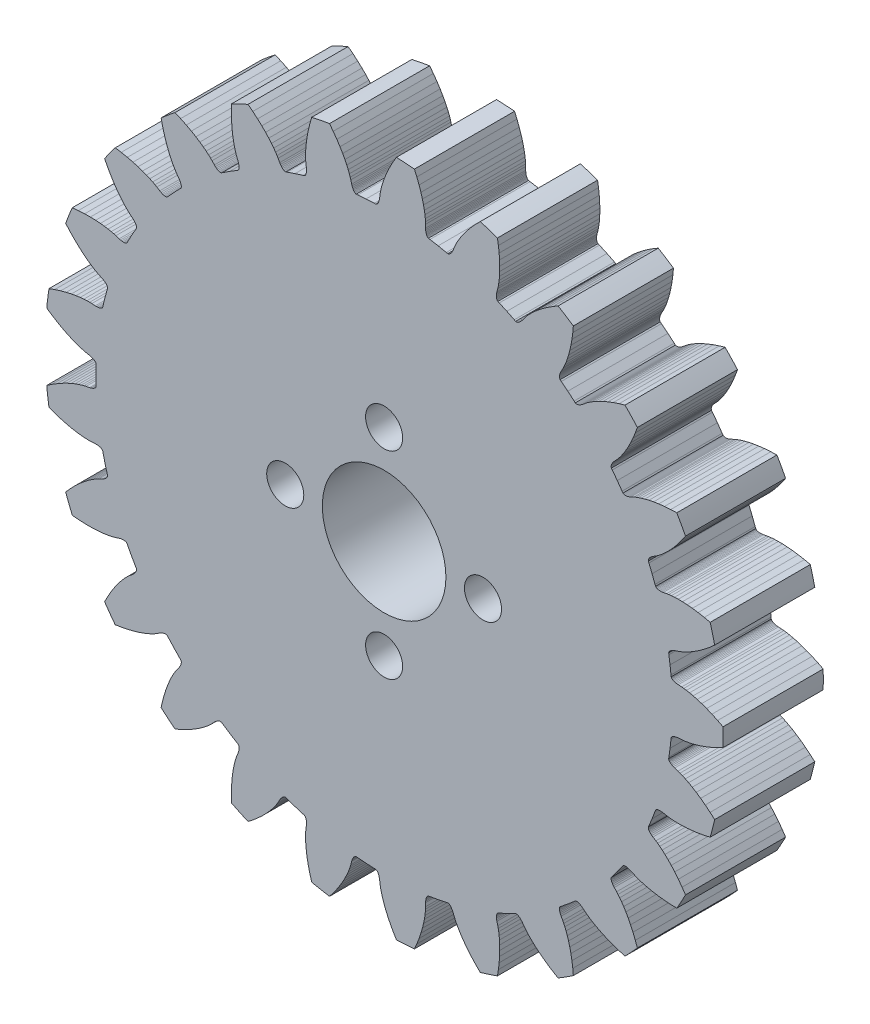
from build123d import *
from build123d.topology import SkipClean

# Parameters (mm, degrees)
BOSS_EXTRUDE1_DEPTH      = 8
BOSS_EXTRUDE1_DEPTH_BACK = 0.1
SKETCH1_R                = 2.032
SKETCH2_R                = 5
CUT_EXTRUDE1_DEPTH       = 10
SKETCH3_R                = 1.5
CUT_EXTRUDE2_DEPTH       = 61.018493099
SKETCH4_R                = 11
SKETCH4_R_2              = 1.5
SKETCH4_R_3              = 5
BOSS_EXTRUDE2_DEPTH      = 3


with BuildPart() as part:
    # Sketch1 → Boss-Extrude1 (new, two sides: drawn at the far end of the back side and taken through both)
    with BuildSketch(Plane.XY.offset(-BOSS_EXTRUDE1_DEPTH_BACK)):
        with BuildLine():
            Line((51.445940215, 5.273928948), (51.051911742, 4.954092656))
            Line((51.051911742, 4.954092656), (50.678490696, 4.676061411))
            Line((50.678490696, 4.676061411), (50.326925333, 4.436521021))
            Line((50.326925333, 4.436521021), (50.003011528, 4.23514911))
            Line((50.003011528, 4.23514911), (49.707087304, 4.06789204))
            Line((49.707087304, 4.06789204), (49.441380546, 3.93203059))
            Line((49.441380546, 3.93203059), (49.20848185, 3.824973451))
            Line((49.20848185, 3.824973451), (49.009888597, 3.743540746))
            Line((49.009888597, 3.743540746), (48.84710335, 3.684593848))
            Line((48.84710335, 3.684593848), (48.582403143, 3.600022313))
            Line((48.582403143, 3.600022313), (48.479969413, 3.559616298))
            Line((48.479969413, 3.559616298), (48.38955598, 3.516960046))
            Line((48.38955598, 3.516960046), (48.311184686, 3.472527724))
            Line((48.311184686, 3.472527724), (48.244904097, 3.426826927))
            Line((48.244904097, 3.426826927), (48.190727421, 3.380320441))
            Line((48.190727421, 3.380320441), (48.148631493, 3.333517182))
            Line((48.148631493, 3.333517182), (48.118629318, 3.286879734))
            Line((48.118629318, 3.286879734), (48.100677512, 3.240914573))
            Line((48.100677512, 3.240914573), (48.094727613, 3.196086723))
            Line((48.094727613, 3.196086723), (48.112060776, 3.074363319))
            Line((48.112060776, 3.074363319), (48.205688529, 2.409666756))
            Line((48.205688529, 2.409666756), (48.280305601, 1.742568573))
            Line((48.280305601, 1.742568573), (48.293788328, 1.620358708))
            Line((48.293788328, 1.620358708), (48.310699546, 1.57841894))
            Line((48.310699546, 1.57841894), (48.339518386, 1.538362327))
            Line((48.339518386, 1.538362327), (48.380176268, 1.500651252))
            Line((48.380176268, 1.500651252), (48.432589269, 1.465787313))
            Line((48.432589269, 1.465787313), (48.496629476, 1.434215012))
            Line((48.496629476, 1.434215012), (48.572193054, 1.406433406))
            Line((48.572193054, 1.406433406), (48.659152088, 1.382887098))
            Line((48.659152088, 1.382887098), (48.757333248, 1.364055944))
            Line((48.757333248, 1.364055944), (48.866597342, 1.350393488))
            Line((48.866597342, 1.350393488), (49.1440135, 1.334307261))
            Line((49.1440135, 1.334307261), (49.316344169, 1.317695356))
            Line((49.316344169, 1.317695356), (49.528949688, 1.288209106))
            Line((49.528949688, 1.288209106), (49.781155533, 1.242434953))
            Line((49.781155533, 1.242434953), (50.072302017, 1.176920428))
            Line((50.072302017, 1.176920428), (50.400524272, 1.08851136))
            Line((50.400524272, 1.08851136), (50.764340968, 0.974019945))
            Line((50.764340968, 0.974019945), (51.164432523, 0.829436033))
            Line((51.164432523, 0.829436033), (51.595265392, 0.653005601))
            Line((51.595265392, 0.653005601), (52.056454716, 0.441208514))
            Line((52.056454716, 0.441208514), (52.494586632, 0.218276168))
            ThreePointArc((52.494586632, 0.218276168), (52.504328888, -0.512753358), (52.494586634, -1.243782885))
            Line((52.494586634, -1.243782885), (52.056454752, -1.466715128))
            Line((52.056454752, -1.466715128), (51.595265428, -1.678512215))
            Line((51.595265428, -1.678512215), (51.164432558, -1.854942647))
            Line((51.164432558, -1.854942647), (50.764341004, -1.999526559))
            Line((50.764341004, -1.999526559), (50.400524307, -2.114017973))
            Line((50.400524307, -2.114017973), (50.072302053, -2.202427042))
            Line((50.072302053, -2.202427042), (49.781155569, -2.267941567))
            Line((49.781155569, -2.267941567), (49.528949723, -2.31371572))
            Line((49.528949723, -2.31371572), (49.316344205, -2.34320197))
            Line((49.316344205, -2.34320197), (49.144013536, -2.359813875))
            Line((49.144013536, -2.359813875), (48.866597377, -2.375900101))
            Line((48.866597377, -2.375900101), (48.757333283, -2.389562558))
            Line((48.757333283, -2.389562558), (48.659152123, -2.408393712))
            Line((48.659152123, -2.408393712), (48.572193089, -2.43194002))
            Line((48.572193089, -2.43194002), (48.496629512, -2.459721625))
            Line((48.496629512, -2.459721625), (48.432589305, -2.491293927))
            Line((48.432589305, -2.491293927), (48.380176303, -2.526157865))
            Line((48.380176303, -2.526157865), (48.339518421, -2.56386894))
            Line((48.339518421, -2.56386894), (48.310699581, -2.603925553))
            Line((48.310699581, -2.603925553), (48.293788363, -2.645865322))
            Line((48.293788363, -2.645865322), (48.280305637, -2.768075187))
            Line((48.280305637, -2.768075187), (48.205688565, -3.43517337))
            Line((48.205688565, -3.43517337), (48.112060812, -4.099869932))
            Line((48.112060812, -4.099869932), (48.094727649, -4.221593336))
            Line((48.094727649, -4.221593336), (48.100677548, -4.266421187))
            Line((48.100677548, -4.266421187), (48.118629353, -4.312386348))
            Line((48.118629353, -4.312386348), (48.148631529, -4.359023796))
            Line((48.148631529, -4.359023796), (48.190727457, -4.405827055))
            Line((48.190727457, -4.405827055), (48.244904133, -4.45233354))
            Line((48.244904133, -4.45233354), (48.311184721, -4.498034338))
            Line((48.311184721, -4.498034338), (48.389556015, -4.54246666))
            Line((48.389556015, -4.54246666), (48.479969449, -4.585122912))
            Line((48.479969449, -4.585122912), (48.582403178, -4.625528927))
            Line((48.582403178, -4.625528927), (48.847103385, -4.710100462))
            Line((48.847103385, -4.710100462), (49.009888633, -4.76904736))
            Line((49.009888633, -4.76904736), (49.208481885, -4.850480064))
            Line((49.208481885, -4.850480064), (49.441380581, -4.957537204))
            Line((49.441380581, -4.957537204), (49.70708734, -5.093398654))
            Line((49.70708734, -5.093398654), (50.003011564, -5.260655724))
            Line((50.003011564, -5.260655724), (50.326925369, -5.462027635))
            Line((50.326925369, -5.462027635), (50.678490731, -5.701568024))
            Line((50.678490731, -5.701568024), (51.051911777, -5.979599269))
            Line((51.051911777, -5.979599269), (51.44594025, -6.299435561))
            Line((51.44594025, -6.299435561), (51.814866411, -6.624322999))
            ThreePointArc((51.814866411, -6.624322999), (51.642502956, -7.334808644), (51.451267136, -8.04044869))
            Line((51.451267136, -8.04044869), (50.97145887, -8.147418242))
            Line((50.97145887, -8.147418242), (50.472086843, -8.23786815))
            Line((50.472086843, -8.23786815), (50.010912963, -8.301611889))
            Line((50.010912963, -8.301611889), (49.587434307, -8.342154759))
            Line((49.587434307, -8.342154759), (49.20657482, -8.362571685))
            Line((49.20657482, -8.362571685), (48.866677811, -8.366577672))
            Line((48.866677811, -8.366577672), (48.568385495, -8.357628744))
            Line((48.568385495, -8.357628744), (48.312719559, -8.339243716))
            Line((48.312719559, -8.339243716), (48.099460448, -8.314930836))
            Line((48.099460448, -8.314930836), (47.928412784, -8.288163909))
            Line((47.928412784, -8.288163909), (47.655711577, -8.234754212))
            Line((47.655711577, -8.234754212), (47.546482535, -8.22081459))
            Line((47.546482535, -8.22081459), (47.4467028, -8.214637412))
            Line((47.4467028, -8.214637412), (47.356619973, -8.215818207))
            Line((47.356619973, -8.215818207), (47.276521378, -8.223935133))
            Line((47.276521378, -8.223935133), (47.206641406, -8.238589307))
            Line((47.206641406, -8.238589307), (47.147204695, -8.259323429))
            Line((47.147204695, -8.259323429), (47.098445839, -8.285738413))
            Line((47.098445839, -8.285738413), (47.060570679, -8.317369642))
            Line((47.060570679, -8.317369642), (47.033760776, -8.353786232))
            Line((47.033760776, -8.353786232), (46.990309301, -8.468803528))
            Line((46.990309301, -8.468803528), (46.752135939, -9.096387134))
            Line((46.752135939, -9.096387134), (46.496146307, -9.716916754))
            Line((46.496146307, -9.716916754), (46.449086304, -9.830505351))
            Line((46.449086304, -9.830505351), (46.443701098, -9.875404626))
            Line((46.443701098, -9.875404626), (46.449657804, -9.92439005))
            Line((46.449657804, -9.92439005), (46.467119085, -9.977023524))
            Line((46.467119085, -9.977023524), (46.496253088, -10.032825292))
            Line((46.496253088, -10.032825292), (46.537162023, -10.091343844))
            Line((46.537162023, -10.091343844), (46.589994938, -10.152092109))
            Line((46.589994938, -10.152092109), (46.654854143, -10.214618781))
            Line((46.654854143, -10.214618781), (46.731818987, -10.278419721))
            Line((46.731818987, -10.278419721), (46.820985891, -10.343030615))
            Line((46.820985891, -10.343030615), (47.056338023, -10.490773373))
            Line((47.056338023, -10.490773373), (47.199349574, -10.588351435))
            Line((47.199349574, -10.588351435), (47.371452151, -10.716613917))
            Line((47.371452151, -10.716613917), (47.570409944, -10.878227208))
            Line((47.570409944, -10.878227208), (47.793981659, -11.075898847))
            Line((47.793981659, -11.075898847), (48.03901363, -11.311494617))
            Line((48.03901363, -11.311494617), (48.302671929, -11.587094167))
            Line((48.302671929, -11.587094167), (48.583621024, -11.906539705))
            Line((48.583621024, -11.906539705), (48.876166743, -12.268702151))
            Line((48.876166743, -12.268702151), (49.178276071, -12.676481066))
            Line((49.178276071, -12.676481066), (49.454815523, -13.082909717))
            ThreePointArc((49.454815523, -13.082909717), (49.11117659, -13.728209127), (48.750463251, -14.364121803))
            Line((48.750463251, -14.364121803), (48.259126861, -14.348407201))
            Line((48.259126861, -14.348407201), (47.752949463, -14.311826731))
            Line((47.752949463, -14.311826731), (47.290411806, -14.258878602))
            Line((47.290411806, -14.258878602), (46.870154988, -14.192832912))
            Line((46.870154988, -14.192832912), (46.496183371, -14.117892448))
            Line((46.496183371, -14.117892448), (46.165968538, -14.037243587))
            Line((46.165968538, -14.037243587), (45.87927315, -13.954393562))
            Line((45.87927315, -13.954393562), (45.636211609, -13.873004647))
            Line((45.636211609, -13.873004647), (45.435698827, -13.796420091))
            Line((45.435698827, -13.796420091), (45.276681518, -13.727956423))
            Line((45.276681518, -13.727956423), (45.025830203, -13.608406548))
            Line((45.025830203, -13.608406548), (44.923499496, -13.567740741))
            Line((44.923499496, -13.567740741), (44.82839072, -13.536943444))
            Line((44.82839072, -13.536943444), (44.740844438, -13.515684356))
            Line((44.740844438, -13.515684356), (44.661243683, -13.503626569))
            Line((44.661243683, -13.503626569), (44.589914692, -13.500441917))
            Line((44.589914692, -13.500441917), (44.527188986, -13.505743405))
            Line((44.527188986, -13.505743405), (44.473392802, -13.519202662))
            Line((44.473392802, -13.519202662), (44.428841202, -13.540421009))
            Line((44.428841202, -13.540421009), (44.393817142, -13.569026083))
            Line((44.393817142, -13.569026083), (44.323127113, -13.669624002))
            Line((44.323127113, -13.669624002), (43.936362634, -14.218259532))
            Line((43.936362634, -14.218259532), (43.534096026, -14.755632092))
            Line((43.534096026, -14.755632092), (43.460266151, -14.853948786))
            Line((43.460266151, -14.853948786), (43.443884066, -14.896098156))
            Line((43.443884066, -14.896098156), (43.43747148, -14.945026074))
            Line((43.43747148, -14.945026074), (43.44129479, -15.000348392))
            Line((43.44129479, -15.000348392), (43.455636239, -15.061642351))
            Line((43.455636239, -15.061642351), (43.480706852, -15.128496065))
            Line((43.480706852, -15.128496065), (43.516772515, -15.20047489))
            Line((43.516772515, -15.20047489), (43.564044252, -15.277166939))
            Line((43.564044252, -15.277166939), (43.62272445, -15.358103836))
            Line((43.62272445, -15.358103836), (43.693021998, -15.442859775))
            Line((43.693021998, -15.442859775), (43.884237871, -15.644490563))
            Line((43.884237871, -15.644490563), (43.998489916, -15.774568535))
            Line((43.998489916, -15.774568535), (44.133287919, -15.941601678))
            Line((44.133287919, -15.941601678), (44.28580354, -16.147616303))
            Line((44.28580354, -16.147616303), (44.453192385, -16.394677836))
            Line((44.453192385, -16.394677836), (44.631935944, -16.68380888))
            Line((44.631935944, -16.68380888), (44.818772146, -17.016319163))
            Line((44.818772146, -17.016319163), (45.011451873, -17.395597856))
            Line((45.011451873, -17.395597856), (45.20474059, -17.81913554))
            Line((45.20474059, -17.81913554), (45.39594803, -18.289234778))
            Line((45.39594803, -18.289234778), (45.562724735, -18.751667381))
            ThreePointArc((45.562724735, -18.751667381), (45.069402391, -19.291233998), (44.56187645, -19.81746255))
            Line((44.56187645, -19.81746255), (44.089884406, -19.680051205))
            Line((44.089884406, -19.680051205), (43.608706806, -19.518738853))
            Line((43.608706806, -19.518738853), (43.173868255, -19.352425648))
            Line((43.173868255, -19.352425648), (42.78323942, -19.18394125))
            Line((42.78323942, -19.18394125), (42.439653823, -19.018352249))
            Line((42.439653823, -19.018352249), (42.139869815, -18.858116146))
            Line((42.139869815, -18.858116146), (41.882785442, -18.706570704))
            Line((41.882785442, -18.706570704), (41.667600808, -18.567291836))
            Line((41.667600808, -18.567291836), (41.492433264, -18.443247888))
            Line((41.492433264, -18.443247888), (41.355437957, -18.337389019))
            Line((41.355437957, -18.337389019), (41.142198455, -18.159210965))
            Line((41.142198455, -18.159210965), (41.053195839, -18.094374011))
            Line((41.053195839, -18.094374011), (40.968734032, -18.040891669))
            Line((40.968734032, -18.040891669), (40.889225021, -17.998528635))
            Line((40.889225021, -17.998528635), (40.815123772, -17.967053768))
            Line((40.815123772, -17.967053768), (40.746827744, -17.946230441))
            Line((40.746827744, -17.946230441), (40.684754208, -17.935765946))
            Line((40.684754208, -17.935765946), (40.62930103, -17.93542396))
            Line((40.62930103, -17.93542396), (40.580872272, -17.944896128))
            Line((40.580872272, -17.944896128), (40.539834712, -17.963892382))
            Line((40.539834712, -17.963892382), (40.446347878, -18.04374988))
            Line((40.446347878, -18.04374988), (39.93529429, -18.478964656))
            Line((39.93529429, -18.478964656), (39.412026452, -18.899415022))
            Line((39.412026452, -18.899415022), (39.316065658, -18.976282128))
            Line((39.316065658, -18.976282128), (39.289716206, -19.013033286))
            Line((39.289716206, -19.013033286), (39.271337274, -19.058829283))
            Line((39.271337274, -19.058829283), (39.261282328, -19.113364404))
            Line((39.261282328, -19.113364404), (39.259929931, -19.176299203))
            Line((39.259929931, -19.176299203), (39.267587116, -19.247287428))
            Line((39.267587116, -19.247287428), (39.284619239, -19.325973986))
            Line((39.284619239, -19.325973986), (39.311333435, -19.412012727))
            Line((39.311333435, -19.412012727), (39.34804182, -19.504999993))
            Line((39.34804182, -19.504999993), (39.395052952, -19.60457541))
            Line((39.395052952, -19.60457541), (39.530117859, -19.847425115))
            Line((39.530117859, -19.847425115), (39.608431342, -20.001829784))
            Line((39.608431342, -20.001829784), (39.697454989, -20.197138106))
            Line((39.697454989, -20.197138106), (39.79394522, -20.434609513))
            Line((39.79394522, -20.434609513), (39.894633564, -20.715537069))
            Line((39.894633564, -20.715537069), (39.995857644, -21.040036293))
            Line((39.995857644, -21.040036293), (40.094132072, -21.408564385))
            Line((40.094132072, -21.408564385), (40.186435571, -21.823844835))
            Line((40.186435571, -21.823844835), (40.268322326, -22.282145264))
            Line((40.268322326, -22.282145264), (40.33661368, -22.78502686))
            Line((40.33661368, -22.78502686), (40.383148512, -23.274406932))
            ThreePointArc((40.383148512, -23.274406932), (39.771140033, -23.674337779), (39.148691232, -24.05781731))
            Line((39.148691232, -24.05781731), (38.725700501, -23.807343485))
            Line((38.725700501, -23.807343485), (38.299756725, -23.531434969))
            Line((38.299756725, -23.531434969), (37.919939857, -23.262206856))
            Line((37.919939857, -23.262206856), (37.583483736, -23.001870369))
            Line((37.583483736, -23.001870369), (37.291872736, -22.756037383))
            Line((37.291872736, -22.756037383), (37.041356194, -22.526281988))
            Line((37.041356194, -22.526281988), (36.830036424, -22.315563385))
            Line((36.830036424, -22.315563385), (36.65624942, -22.127145982))
            Line((36.65624942, -22.127145982), (36.517433544, -21.963436682))
            Line((36.517433544, -21.963436682), (36.4110683, -21.826834263))
            Line((36.4110683, -21.826834263), (36.248839212, -21.601223437))
            Line((36.248839212, -21.601223437), (36.178756954, -21.516289393))
            Line((36.178756954, -21.516289393), (36.110249192, -21.443482528))
            Line((36.110249192, -21.443482528), (36.043773429, -21.382677366))
            Line((36.043773429, -21.382677366), (35.979827608, -21.333763164))
            Line((35.979827608, -21.333763164), (35.918855823, -21.296609365))
            Line((35.918855823, -21.296609365), (35.861334881, -21.271036746))
            Line((35.861334881, -21.271036746), (35.807708877, -21.256914753))
            Line((35.807708877, -21.256914753), (35.758445984, -21.254045569))
            Line((35.758445984, -21.254045569), (35.71397353, -21.262239406))
            Line((35.71397353, -21.262239406), (35.603563997, -21.316338866))
            Line((35.603563997, -21.316338866), (35.000332488, -21.61078674))
            Line((35.000332488, -21.61078674), (34.388942398, -21.887896473))
            Line((34.388942398, -21.887896473), (34.276880341, -21.938484129))
            Line((34.276880341, -21.938484129), (34.242219095, -21.96752781))
            Line((34.242219095, -21.96752781), (34.2130285, -22.00731437))
            Line((34.2130285, -22.00731437), (34.18972715, -22.05763563))
            Line((34.18972715, -22.05763563), (34.172766046, -22.118256896))
            Line((34.172766046, -22.118256896), (34.162528525, -22.188919188))
            Line((34.162528525, -22.188919188), (34.159457056, -22.269369421))
            Line((34.159457056, -22.269369421), (34.163934974, -22.359348514))
            Line((34.163934974, -22.359348514), (34.176365124, -22.458543541))
            Line((34.176365124, -22.458543541), (34.197135822, -22.566681704))
            Line((34.197135822, -22.566681704), (34.267563215, -22.835491225))
            Line((34.267563215, -22.835491225), (34.305017445, -23.004520706))
            Line((34.305017445, -23.004520706), (34.342673047, -23.215832349))
            Line((34.342673047, -23.215832349), (34.377075213, -23.469839359))
            Line((34.377075213, -23.469839359), (34.404736321, -23.766981158))
            Line((34.404736321, -23.766981158), (34.422080559, -24.106459066))
            Line((34.422080559, -24.106459066), (34.425618372, -24.487849007))
            Line((34.425618372, -24.487849007), (34.411745908, -24.91303759))
            Line((34.411745908, -24.91303759), (34.377085373, -25.377304074))
            Line((34.377085373, -25.377304074), (34.318169667, -25.881370122))
            Line((34.318169667, -25.881370122), (34.24153868, -26.366948119))
            ThreePointArc((34.24153868, -26.366948119), (33.549298816, -26.602114095), (32.851037908, -26.818749202))
            Line((32.851037908, -26.818749202), (32.503626485, -26.470950861))
            Line((32.503626485, -26.470950861), (32.159680106, -26.097782697))
            Line((32.159680106, -26.097782697), (31.858750152, -25.74255628))
            Line((31.858750152, -25.74255628), (31.59760757, -25.406725405))
            Line((31.59760757, -25.406725405), (31.376294221, -25.096094987))
            Line((31.376294221, -25.096094987), (31.19078593, -24.811256949))
            Line((31.19078593, -24.811256949), (31.038508765, -24.554605291))
            Line((31.038508765, -24.554605291), (30.917039056, -24.328888292))
            Line((30.917039056, -24.328888292), (30.823297206, -24.135800134))
            Line((30.823297206, -24.135800134), (30.754245274, -23.977037434))
            Line((30.754245274, -23.977037434), (30.653220025, -23.718169778))
            Line((30.653220025, -23.718169778), (30.606461775, -23.618475387))
            Line((30.606461775, -23.618475387), (30.558212646, -23.530918743))
            Line((30.558212646, -23.530918743), (30.508947009, -23.45549202))
            Line((30.508947009, -23.45549202), (30.459174592, -23.392211781))
            Line((30.459174592, -23.392211781), (30.40935808, -23.341062277))
            Line((30.40935808, -23.341062277), (30.360003949, -23.301988136))
            Line((30.360003949, -23.301988136), (30.311574684, -23.274973509))
            Line((30.311574684, -23.274973509), (30.264573101, -23.259943313))
            Line((30.264573101, -23.259943313), (30.21946006, -23.256819926))
            Line((30.21946006, -23.256819926), (30.099065279, -23.281762015))
            Line((30.099065279, -23.281762015), (29.441559253, -23.416941627))
            Line((29.441559253, -23.416941627), (28.780462684, -23.533298926))
            Line((28.780462684, -23.533298926), (28.659340549, -23.554428576))
            Line((28.659340549, -23.554428576), (28.618545405, -23.573939942))
            Line((28.618545405, -23.573939942), (28.580377333, -23.605217095))
            Line((28.580377333, -23.605217095), (28.545293634, -23.648162603))
            Line((28.545293634, -23.648162603), (28.513789506, -23.702661249))
            Line((28.513789506, -23.702661249), (28.486300712, -23.768557688))
            Line((28.486300712, -23.768557688), (28.463318487, -23.845716487))
            Line((28.463318487, -23.845716487), (28.445278899, -23.933982402))
            Line((28.445278899, -23.933982402), (28.432649714, -24.033152231))
            Line((28.432649714, -24.033152231), (28.425875026, -24.143058641))
            Line((28.425875026, -24.143058641), (28.427239616, -24.420937486))
            Line((28.427239616, -24.420937486), (28.421481233, -24.593971023))
            Line((28.421481233, -24.593971023), (28.405402728, -24.808008594))
            Line((28.405402728, -24.808008594), (28.375555086, -25.062590863))
            Line((28.375555086, -25.062590863), (28.328451091, -25.357276482))
            Line((28.328451091, -25.357276482), (28.260825623, -25.69040246))
            Line((28.260825623, -25.69040246), (28.169404419, -26.060690163))
            Line((28.169404419, -26.060690163), (28.050227721, -26.469070753))
            Line((28.050227721, -26.469070753), (27.901197691, -26.910131593))
            Line((27.901197691, -26.910131593), (27.718776923, -27.383709818))
            Line((27.718776923, -27.383709818), (27.523795042, -27.834975159))
            ThreePointArc((27.523795042, -27.834975159), (26.79481981, -27.890599899), (26.064621135, -27.926778581))
            Line((26.064621135, -27.926778581), (25.814618068, -27.503509296))
            Line((25.814618068, -27.503509296), (25.574280626, -27.056528833))
            Line((25.574280626, -27.056528833), (25.371146158, -26.63762421))
            Line((25.371146158, -26.63762421), (25.201725516, -26.247400657))
            Line((25.201725516, -26.247400657), (25.064615808, -25.891490879))
            Line((25.064615808, -25.891490879), (24.955771932, -25.569467444))
            Line((24.955771932, -25.569467444), (24.872105449, -25.283009292))
            Line((24.872105449, -25.283009292), (24.810585532, -25.034175245))
            Line((24.810585532, -25.034175245), (24.767807868, -24.82384069))
            Line((24.767807868, -24.82384069), (24.740407973, -24.652893204))
            Line((24.740407973, -24.652893204), (24.706934329, -24.377034472))
            Line((24.706934329, -24.377034472), (24.686438155, -24.268843883))
            Line((24.686438155, -24.268843883), (24.661479302, -24.172038895))
            Line((24.661479302, -24.172038895), (24.632519238, -24.086729947))
            Line((24.632519238, -24.086729947), (24.600047776, -24.013059889))
            Line((24.600047776, -24.013059889), (24.564516631, -23.951128491))
            Line((24.564516631, -23.951128491), (24.526430448, -23.901007992))
            Line((24.526430448, -23.901007992), (24.486240943, -23.862798264))
            Line((24.486240943, -23.862798264), (24.444453777, -23.836551428))
            Line((24.444453777, -23.836551428), (24.401534889, -23.822307006))
            Line((24.401534889, -23.822307006), (24.27871959, -23.816524544))
            Line((24.27871959, -23.816524544), (23.608252554, -23.783942135))
            Line((23.608252554, -23.783942135), (22.938988665, -23.732235863))
            Line((22.938988665, -23.732235863), (22.816417104, -23.722579901))
            Line((22.816417104, -23.722579901), (22.772051331, -23.731332842))
            Line((22.772051331, -23.731332842), (22.727304049, -23.752135341))
            Line((22.727304049, -23.752135341), (22.682642518, -23.7850067))
            Line((22.682642518, -23.7850067), (22.638574839, -23.829958502))
            Line((22.638574839, -23.829958502), (22.595561869, -23.886948381))
            Line((22.595561869, -23.886948381), (22.554113133, -23.955967699))
            Line((22.554113133, -23.955967699), (22.514689285, -24.036974293))
            Line((22.514689285, -24.036974293), (22.477794464, -24.129887798))
            Line((22.477794464, -24.129887798), (22.443899993, -24.234656397))
            Line((22.443899993, -24.234656397), (22.376116029, -24.504144606))
            Line((22.376116029, -24.504144606), (22.32750683, -24.670309984))
            Line((22.32750683, -24.670309984), (22.258704529, -24.873624487))
            Line((22.258704529, -24.873624487), (22.166482514, -25.112785909))
            Line((22.166482514, -25.112785909), (22.047573024, -25.386499153))
            Line((22.047573024, -25.386499153), (21.899227168, -25.692341468))
            Line((21.899227168, -25.692341468), (21.718591309, -26.02826043))
            Line((21.718591309, -26.02826043), (21.501598703, -26.394172932))
            Line((21.501598703, -26.394172932), (21.247563244, -26.784314798))
            Line((21.247563244, -26.784314798), (20.953099419, -27.19764849))
            Line((20.953099419, -27.19764849), (20.652018182, -27.586246443))
            ThreePointArc((20.652018182, -27.586246443), (19.932111702, -27.45883485), (19.215856256, -27.312283872))
            Line((19.215856256, -27.312283872), (19.07897037, -26.840139251))
            Line((19.07897037, -26.840139251), (18.95734308, -26.347431982))
            Line((18.95734308, -26.347431982), (18.8647677, -25.891170562))
            Line((18.8647677, -25.891170562), (18.797714443, -25.471073358))
            Line((18.797714443, -25.471073358), (18.753423447, -25.092247395))
            Line((18.753423447, -25.092247395), (18.728083086, -24.75327261))
            Line((18.728083086, -24.75327261), (18.718284478, -24.455006912))
            Line((18.718284478, -24.455006912), (18.720579723, -24.198691143))
            Line((18.720579723, -24.198691143), (18.731454073, -23.984326218))
            Line((18.731454073, -23.984326218), (18.74742793, -23.8119353))
            Line((18.74742793, -23.8119353), (18.783609214, -23.536418655))
            Line((18.783609214, -23.536418655), (18.790662794, -23.426529822))
            Line((18.790662794, -23.426529822), (18.790562616, -23.326559182))
            Line((18.790562616, -23.326559182), (18.783727781, -23.236728322))
            Line((18.783727781, -23.236728322), (18.770597403, -23.157297442))
            Line((18.770597403, -23.157297442), (18.751584386, -23.088475431))
            Line((18.751584386, -23.088475431), (18.727159136, -23.03045797))
            Line((18.727159136, -23.03045797), (18.697734557, -22.98345395))
            Line((18.697734557, -22.98345395), (18.663787558, -22.947639645))
            Line((18.663787558, -22.947639645), (18.625759491, -22.923169183))
            Line((18.625759491, -22.923169183), (18.508240803, -22.887025491))
            Line((18.508240803, -22.887025491), (17.866940587, -22.688728301))
            Line((17.866940587, -22.688728301), (17.231561721, -22.472207322))
            Line((17.231561721, -22.472207322), (17.115242218, -22.4323724))
            Line((17.115242218, -22.4323724), (17.070093514, -22.429817058))
            Line((17.070093514, -22.429817058), (17.021578702, -22.438837919))
            Line((17.021578702, -22.438837919), (16.97014553, -22.459569602))
            Line((16.97014553, -22.459569602), (16.916283306, -22.492149979))
            Line((16.916283306, -22.492149979), (16.860448823, -22.536652506))
            Line((16.860448823, -22.536652506), (16.803137787, -22.59319565))
            Line((16.803137787, -22.59319565), (16.744807094, -22.661852866))
            Line((16.744807094, -22.661852866), (16.685964742, -22.742672008))
            Line((16.685964742, -22.742672008), (16.627080227, -22.83571993))
            Line((16.627080227, -22.83571993), (16.494406883, -23.07988444))
            Line((16.494406883, -23.07988444), (16.406001167, -23.228740734))
            Line((16.406001167, -23.228740734), (16.288798049, -23.408557392))
            Line((16.288798049, -23.408557392), (16.139996416, -23.617270411))
            Line((16.139996416, -23.617270411), (15.956752993, -23.852812841))
            Line((15.956752993, -23.852812841), (15.737007738, -24.112154562))
            Line((15.737007738, -24.112154562), (15.478507264, -24.392597588))
            Line((15.478507264, -24.392597588), (15.177333063, -24.693050429))
            Line((15.177333063, -24.693050429), (14.834254349, -25.007759274))
            Line((14.834254349, -25.007759274), (14.44624974, -25.334877034))
            Line((14.44624974, -25.334877034), (14.057987067, -25.636390681))
            ThreePointArc((14.057987067, -25.636390681), (13.392383758, -25.333948501), (12.735076549, -25.013876211))
            Line((12.735076549, -25.013876211), (12.719908867, -24.522522657))
            Line((12.719908867, -24.522522657), (12.724633978, -24.015047319))
            Line((12.724633978, -24.015047319), (12.748434693, -23.550097576))
            Line((12.748434693, -23.550097576), (12.78796197, -23.12652301))
            Line((12.78796197, -23.12652301), (12.839272611, -22.748583913))
            Line((12.839272611, -22.748583913), (12.89902794, -22.413956693))
            Line((12.89902794, -22.413956693), (12.963712799, -22.122624789))
            Line((12.963712799, -22.122624789), (13.029679139, -21.874932422))
            Line((13.029679139, -21.874932422), (13.093522242, -21.670006543))
            Line((13.093522242, -21.670006543), (13.151866042, -21.507004075))
            Line((13.151866042, -21.507004075), (13.255428853, -21.249141243))
            Line((13.255428853, -21.249141243), (13.28958911, -21.144458902))
            Line((13.28958911, -21.144458902), (13.314353703, -21.047604029))
            Line((13.314353703, -21.047604029), (13.330073662, -20.958895646))
            Line((13.330073662, -20.958895646), (13.337109563, -20.878694841))
            Line((13.337109563, -20.878694841), (13.335809083, -20.807306719))
            Line((13.335809083, -20.807306719), (13.326579638, -20.745037603))
            Line((13.326579638, -20.745037603), (13.309768902, -20.692192801))
            Line((13.309768902, -20.692192801), (13.285795061, -20.649061366))
            Line((13.285795061, -20.649061366), (13.255047243, -20.615902581))
            Line((13.255047243, -20.615902581), (13.15020915, -20.551668622))
            Line((13.15020915, -20.551668622), (12.578371126, -20.200116468))
            Line((12.578371126, -20.200116468), (12.016800393, -19.832385529))
            Line((12.016800393, -19.832385529), (11.914041848, -19.764874666))
            Line((11.914041848, -19.764874666), (11.87094709, -19.751171569))
            Line((11.87094709, -19.751171569), (11.821713051, -19.747843763))
            Line((11.821713051, -19.747843763), (11.766739933, -19.755133258))
            Line((11.766739933, -19.755133258), (11.70646746, -19.773295071))
            Line((11.70646746, -19.773295071), (11.641319813, -19.802514012))
            Line((11.641319813, -19.802514012), (11.571747689, -19.843028028))
            Line((11.571747689, -19.843028028), (11.498175166, -19.895022133))
            Line((11.498175166, -19.895022133), (11.421082509, -19.95866864))
            Line((11.421082509, -19.95866864), (11.340907917, -20.034149312))
            Line((11.340907917, -20.034149312), (11.151681473, -20.237648321))
            Line((11.151681473, -20.237648321), (11.029034118, -20.359842539))
            Line((11.029034118, -20.359842539), (10.870794658, -20.504862721))
            Line((10.870794658, -20.504862721), (10.674763046, -20.670013115))
            Line((10.674763046, -20.670013115), (10.43869951, -20.852584759))
            Line((10.43869951, -20.852584759), (10.161362295, -21.049130365))
            Line((10.161362295, -21.049130365), (9.841239796, -21.256476255))
            Line((9.841239796, -21.256476255), (9.474807915, -21.472590936))
            Line((9.474807915, -21.472590936), (9.064242722, -21.692092351))
            Line((9.064242722, -21.692092351), (8.607077164, -21.912440297))
            Line((8.607077164, -21.912440297), (8.156029044, -22.107924285))
            ThreePointArc((8.156029044, -22.107924285), (7.586551186, -21.649455072), (7.029493222, -21.175972786))
            Line((7.029493222, -21.175972786), (7.136996707, -20.696284011))
            Line((7.136996707, -20.696284011), (7.267777446, -20.205926952))
            Line((7.267777446, -20.205926952), (7.406458703, -19.761503559))
            Line((7.406458703, -19.761503559), (7.5500828, -19.361066361))
            Line((7.5500828, -19.361066361), (7.693771108, -19.007761302))
            Line((7.693771108, -19.007761302), (7.8348676, -18.698507564))
            Line((7.8348676, -18.698507564), (7.96997152, -18.432414929))
            Line((7.96997152, -18.432414929), (8.09546398, -18.208909458))
            Line((8.09546398, -18.208909458), (8.208264262, -18.026298698))
            Line((8.208264262, -18.026298698), (8.305312176, -17.882926874))
            Line((8.305312176, -17.882926874), (8.469749337, -17.658920311))
            Line((8.469749337, -17.658920311), (8.528869768, -17.566022047))
            Line((8.528869768, -17.566022047), (8.576943128, -17.47836878))
            Line((8.576943128, -17.47836878), (8.614230125, -17.396356752))
            Line((8.614230125, -17.396356752), (8.640990041, -17.320425281))
            Line((8.640990041, -17.320425281), (8.657483988, -17.250956484))
            Line((8.657483988, -17.250956484), (8.664030178, -17.188348532))
            Line((8.664030178, -17.188348532), (8.66088962, -17.132983136))
            Line((8.66088962, -17.132983136), (8.648395259, -17.085244751))
            Line((8.648395259, -17.085244751), (8.626859716, -17.045481051))
            Line((8.626859716, -17.045481051), (8.541289656, -16.957192987))
            Line((8.541289656, -16.957192987), (8.074844361, -16.474475131))
            Line((8.074844361, -16.474475131), (7.62236744, -15.978640106))
            Line((7.62236744, -15.978640106), (7.539626534, -15.887695304))
            Line((7.539626534, -15.887695304), (7.501293464, -15.863705411))
            Line((7.501293464, -15.863705411), (7.454433816, -15.848238233))
            Line((7.454433816, -15.848238233), (7.399374948, -15.841627426))
            Line((7.399374948, -15.841627426), (7.336479366, -15.844229503))
            Line((7.336479366, -15.844229503), (7.266112019, -15.856328946))
            Line((7.266112019, -15.856328946), (7.188650147, -15.878268247))
            Line((7.188650147, -15.878268247), (7.104458697, -15.910332089))
            Line((7.104458697, -15.910332089), (7.013959818, -15.952806782))
            Line((7.013959818, -15.952806782), (6.91753268, -16.005977516))
            Line((6.91753268, -16.005977516), (6.683642978, -16.156024562))
            Line((6.683642978, -16.156024562), (6.534460447, -16.243878691))
            Line((6.534460447, -16.243878691), (6.345127221, -16.344990199))
            Line((6.345127221, -16.344990199), (6.114183106, -16.456200949))
            Line((6.114183106, -16.456200949), (5.840132244, -16.574330253))
            Line((5.840132244, -16.574330253), (5.522629196, -16.695730061))
            Line((5.522629196, -16.695730061), (5.160999033, -16.816950545))
            Line((5.160999033, -16.816950545), (4.752333861, -16.935147718))
            Line((4.752333861, -16.935147718), (4.300079546, -17.045649707))
            Line((4.300079546, -17.045649707), (3.802478306, -17.145382502))
            Line((3.802478306, -17.145382502), (3.316985856, -17.222554001))
            ThreePointArc((3.316985856, -17.222554001), (2.879415855, -16.63686507), (2.457609153, -16.039723434))
            Line((2.457609153, -16.039723434), (2.681028874, -15.601839852))
            Line((2.681028874, -15.601839852), (2.929647731, -15.159412187))
            Line((2.929647731, -15.159412187), (3.174495705, -14.7634397))
            Line((3.174495705, -14.7634397), (3.413192307, -14.411300907))
            Line((3.413192307, -14.411300907), (3.640229699, -14.104829384))
            Line((3.640229699, -14.104829384), (3.853801636, -13.840380738))
            Line((3.853801636, -13.840380738), (4.050835634, -13.616246769))
            Line((4.050835634, -13.616246769), (4.227969036, -13.430971854))
            Line((4.227969036, -13.430971854), (4.382638983, -13.282150511))
            Line((4.382638983, -13.282150511), (4.51229308, -13.167417796))
            Line((4.51229308, -13.167417796), (4.727272279, -12.99134266))
            Line((4.727272279, -12.99134266), (4.807638184, -12.916065696))
            Line((4.807638184, -12.916065696), (4.875999744, -12.843121569))
            Line((4.875999744, -12.843121569), (4.932510883, -12.772958946))
            Line((4.932510883, -12.772958946), (4.977313435, -12.706067944))
            Line((4.977313435, -12.706067944), (5.010565388, -12.642883514))
            Line((5.010565388, -12.642883514), (5.032475835, -12.583870373))
            Line((5.032475835, -12.583870373), (5.043202763, -12.529463472))
            Line((5.043202763, -12.529463472), (5.042973045, -12.480117672))
            Line((5.042973045, -12.480117672), (5.032002887, -12.436247504))
            Line((5.032002887, -12.436247504), (4.971077532, -12.329452696))
            Line((4.971077532, -12.329452696), (4.639333517, -11.745900091))
            Line((4.639333517, -11.745900091), (4.324381137, -11.153116313))
            Line((4.324381137, -11.153116313), (4.266856741, -11.04445176))
            Line((4.266856741, -11.04445176), (4.235693989, -11.011682611))
            Line((4.235693989, -11.011682611), (4.194153102, -10.985047764))
            Line((4.194153102, -10.985047764), (4.142467963, -10.964952097))
            Line((4.142467963, -10.964952097), (4.080901309, -10.951830965))
            Line((4.080901309, -10.951830965), (4.009735691, -10.946050535))
            Line((4.009735691, -10.946050535), (3.92925132, -10.948036612))
            Line((3.92925132, -10.948036612), (3.839730951, -10.958155565))
            Line((3.839730951, -10.958155565), (3.741512199, -10.976789716))
            Line((3.741512199, -10.976789716), (3.634891533, -11.004309499))
            Line((3.634891533, -11.004309499), (3.371034707, -11.091476609))
            Line((3.371034707, -11.091476609), (3.204690514, -11.139470316))
            Line((3.204690514, -11.139470316), (2.996160273, -11.190319998))
            Line((2.996160273, -11.190319998), (2.744814675, -11.240603464))
            Line((2.744814675, -11.240603464), (2.449996062, -11.286867735))
            Line((2.449996062, -11.286867735), (2.112277052, -11.32549382))
            Line((2.112277052, -11.32549382), (1.731861862, -11.352972251))
            Line((1.731861862, -11.352972251), (1.306641173, -11.365825057))
            Line((1.306641173, -11.365825057), (0.841114545, -11.360384377))
            Line((0.841114545, -11.360384377), (0.334343803, -11.333235536))
            Line((0.334343803, -11.333235536), (-0.155087781, -11.287245382))
            ThreePointArc((-0.155087781, -11.287245382), (-0.433255801, -10.611137702), (-0.693307584, -9.927857296))
            Line((-0.693307584, -9.927857296), (-0.368009791, -9.559292936))
            Line((-0.368009791, -9.559292936), (-0.017174424, -9.192593948))
            Line((-0.017174424, -9.192593948), (0.318455486, -8.869952887))
            Line((0.318455486, -8.869952887), (0.637226299, -8.588238642))
            Line((0.637226299, -8.588238642), (0.933347424, -8.347857411))
            Line((0.933347424, -8.347857411), (1.205975276, -8.144830029))
            Line((1.205975276, -8.144830029), (1.452558882, -7.976738011))
            Line((1.452558882, -7.976738011), (1.670203354, -7.841335081))
            Line((1.670203354, -7.841335081), (1.857024418, -7.735654114))
            Line((1.857024418, -7.735654114), (2.011138004, -7.656769639))
            Line((2.011138004, -7.656769639), (2.263151317, -7.539689253))
            Line((2.263151317, -7.539689253), (2.359713075, -7.486763476))
            Line((2.359713075, -7.486763476), (2.444067389, -7.433111869))
            Line((2.444067389, -7.433111869), (2.516251852, -7.379207278))
            Line((2.516251852, -7.379207278), (2.576282009, -7.325559735))
            Line((2.576282009, -7.325559735), (2.624202564, -7.272629792))
            Line((2.624202564, -7.272629792), (2.660100688, -7.220919558))
            Line((2.660100688, -7.220919558), (2.684020986, -7.170889584))
            Line((2.684020986, -7.170889584), (2.69607034, -7.123037))
            Line((2.69607034, -7.123037), (2.696354921, -7.077816872))
            Line((2.696354921, -7.077816872), (2.663902357, -6.959225796))
            Line((2.663902357, -6.959225796), (2.487704386, -6.311505172))
            Line((2.487704386, -6.311505172), (2.330066093, -5.659019304))
            Line((2.330066093, -5.659019304), (2.301372729, -5.539462926))
            Line((2.301372729, -5.539462926), (2.279338331, -5.499973343))
            Line((2.279338331, -5.499973343), (2.245726308, -5.463844586))
            Line((2.245726308, -5.463844586), (2.200662644, -5.431526642))
            Line((2.200662644, -5.431526642), (2.144293338, -5.403506683))
            Line((2.144293338, -5.403506683), (2.076800966, -5.380209803))
            Line((2.076800966, -5.380209803), (1.998351339, -5.362117789))
            Line((1.998351339, -5.362117789), (1.909126828, -5.349656041))
            Line((1.909126828, -5.349656041), (1.809359692, -5.343278711))
            Line((1.809359692, -5.343278711), (1.699244901, -5.343418411))
            Line((1.699244901, -5.343418411), (1.42200004, -5.362228533))
            Line((1.42200004, -5.362228533), (1.248946284, -5.367346328))
            Line((1.248946284, -5.367346328), (1.034321568, -5.364739069))
            Line((1.034321568, -5.364739069), (0.778367393, -5.350935693))
            Line((0.778367393, -5.350935693), (0.481305554, -5.322428054))
            Line((0.481305554, -5.322428054), (0.14459086, -5.275853293))
            Line((0.14459086, -5.275853293), (-0.230706535, -5.207863081))
            Line((-0.230706535, -5.207863081), (-0.64576448, -5.114564004))
            Line((-0.64576448, -5.114564004), (-1.095312781, -4.993522438))
            Line((-1.095312781, -4.993522438), (-1.57941067, -4.841197825))
            Line((-1.57941067, -4.841197825), (-2.042028592, -4.674935826))
            ThreePointArc((-2.042028592, -4.674935826), (-2.143316257, -3.950891765), (-2.225273057, -3.224405649))
            Line((-2.225273057, -3.224405649), (-1.818536862, -2.948318713))
            Line((-1.818536862, -2.948318713), (-1.387529342, -2.680389353))
            Line((-1.387529342, -2.680389353), (-0.982206302, -2.451352473))
            Line((-0.982206302, -2.451352473), (-0.603390702, -2.257763833))
            Line((-0.603390702, -2.257763833), (-0.256792462, -2.098576953))
            Line((-0.256792462, -2.098576953), (0.057761138, -1.969727833))
            Line((0.057761138, -1.969727833), (0.338400658, -1.868239593))
            Line((0.338400658, -1.868239593), (0.582880738, -1.791216633))
            Line((0.582880738, -1.791216633), (0.790114258, -1.735316313))
            Line((0.790114258, -1.735316313), (0.959003938, -1.697236633))
            Line((0.959003938, -1.697236633), (1.232216498, -1.646507753))
            Line((1.232216498, -1.646507753), (1.338906658, -1.619258633))
            Line((1.338906658, -1.619258633), (1.433953458, -1.588270633))
            Line((1.433953458, -1.588270633), (1.517275618, -1.554011113))
            Line((1.517275618, -1.554011113), (1.588761378, -1.516977913))
            Line((1.588761378, -1.516977913), (1.648339618, -1.477628233))
            Line((1.648339618, -1.477628233), (1.695969698, -1.436470073))
            Line((1.695969698, -1.436470073), (1.731580498, -1.393960633))
            Line((1.731580498, -1.393960633), (1.755151698, -1.350607913))
            Line((1.755151698, -1.350607913), (1.766673138, -1.306879273))
            Line((1.766673138, -1.306879273), (1.764732578, -1.183943273))
            Line((1.764732578, -1.183943273), (1.755151698, -0.512753353))
            Line((1.755151698, -0.512753353), (1.764732578, 0.158436567))
            Line((1.764732578, 0.158436567), (1.766673138, 0.281372567))
            Line((1.766673138, 0.281372567), (1.755151698, 0.325101207))
            Line((1.755151698, 0.325101207), (1.731580498, 0.368453927))
            Line((1.731580498, 0.368453927), (1.695969698, 0.410963367))
            Line((1.695969698, 0.410963367), (1.648339618, 0.452121527))
            Line((1.648339618, 0.452121527), (1.588761378, 0.491471207))
            Line((1.588761378, 0.491471207), (1.517275618, 0.528504407))
            Line((1.517275618, 0.528504407), (1.433953458, 0.562763927))
            Line((1.433953458, 0.562763927), (1.338906658, 0.593751927))
            Line((1.338906658, 0.593751927), (1.232216498, 0.621001047))
            Line((1.232216498, 0.621001047), (0.959003938, 0.671729927))
            Line((0.959003938, 0.671729927), (0.790114258, 0.709809607))
            Line((0.790114258, 0.709809607), (0.582880738, 0.765709927))
            Line((0.582880738, 0.765709927), (0.338400658, 0.842732887))
            Line((0.338400658, 0.842732887), (0.057761138, 0.944221127))
            Line((0.057761138, 0.944221127), (-0.256792462, 1.073070247))
            Line((-0.256792462, 1.073070247), (-0.603390702, 1.232257127))
            Line((-0.603390702, 1.232257127), (-0.982206302, 1.425845767))
            Line((-0.982206302, 1.425845767), (-1.387529342, 1.654882647))
            Line((-1.387529342, 1.654882647), (-1.818536862, 1.922812007))
            Line((-1.818536862, 1.922812007), (-2.225273056, 2.198898933))
            ThreePointArc((-2.225273056, 2.198898933), (-2.14331622, 2.925385059), (-2.042028517, 3.649429129))
            Line((-2.042028517, 3.649429129), (-1.579410591, 3.815691127))
            Line((-1.579410591, 3.815691127), (-1.095312703, 3.96801574))
            Line((-1.095312703, 3.96801574), (-0.645764402, 4.089057306))
            Line((-0.645764402, 4.089057306), (-0.230706456, 4.182356383))
            Line((-0.230706456, 4.182356383), (0.144590939, 4.250346595))
            Line((0.144590939, 4.250346595), (0.481305633, 4.296921356))
            Line((0.481305633, 4.296921356), (0.778367472, 4.325428995))
            Line((0.778367472, 4.325428995), (1.034321646, 4.339232371))
            Line((1.034321646, 4.339232371), (1.248946363, 4.34183963))
            Line((1.248946363, 4.34183963), (1.422000119, 4.336721835))
            Line((1.422000119, 4.336721835), (1.69924498, 4.317911713))
            Line((1.69924498, 4.317911713), (1.809359771, 4.317772013))
            Line((1.809359771, 4.317772013), (1.909126907, 4.324149343))
            Line((1.909126907, 4.324149343), (1.998351417, 4.336611091))
            Line((1.998351417, 4.336611091), (2.076801045, 4.354703105))
            Line((2.076801045, 4.354703105), (2.144293417, 4.377999985))
            Line((2.144293417, 4.377999985), (2.200662722, 4.406019944))
            Line((2.200662722, 4.406019944), (2.245726386, 4.438337888))
            Line((2.245726386, 4.438337888), (2.279338409, 4.474466645))
            Line((2.279338409, 4.474466645), (2.301372808, 4.513956228))
            Line((2.301372808, 4.513956228), (2.330066172, 4.633512605))
            Line((2.330066172, 4.633512605), (2.487704465, 5.285998473))
            Line((2.487704465, 5.285998473), (2.663902436, 5.933719098))
            Line((2.663902436, 5.933719098), (2.696355, 6.052310174))
            Line((2.696355, 6.052310174), (2.696070418, 6.097530302))
            Line((2.696070418, 6.097530302), (2.684021065, 6.145382886))
            Line((2.684021065, 6.145382886), (2.660100767, 6.19541286))
            Line((2.660100767, 6.19541286), (2.624202642, 6.247123094))
            Line((2.624202642, 6.247123094), (2.576282088, 6.300053037))
            Line((2.576282088, 6.300053037), (2.516251931, 6.35370058))
            Line((2.516251931, 6.35370058), (2.444067468, 6.407605171))
            Line((2.444067468, 6.407605171), (2.359713153, 6.461256778))
            Line((2.359713153, 6.461256778), (2.263151396, 6.514182555))
            Line((2.263151396, 6.514182555), (2.011138082, 6.631262941))
            Line((2.011138082, 6.631262941), (1.857024497, 6.710147416))
            Line((1.857024497, 6.710147416), (1.670203433, 6.815828383))
            Line((1.670203433, 6.815828383), (1.452558961, 6.951231313))
            Line((1.452558961, 6.951231313), (1.205975354, 7.119323331))
            Line((1.205975354, 7.119323331), (0.933347502, 7.322350713))
            Line((0.933347502, 7.322350713), (0.637226377, 7.562731944))
            Line((0.637226377, 7.562731944), (0.318455565, 7.844446189))
            Line((0.318455565, 7.844446189), (-0.017174346, 8.16708725))
            Line((-0.017174346, 8.16708725), (-0.368009712, 8.533786237))
            Line((-0.368009712, 8.533786237), (-0.693307512, 8.902350601))
            ThreePointArc((-0.693307512, 8.902350601), (-0.43325573, 9.585631006), (-0.155087709, 10.261738686))
            Line((-0.155087709, 10.261738686), (0.334343867, 10.307728844))
            Line((0.334343867, 10.307728844), (0.841114609, 10.334877685))
            Line((0.841114609, 10.334877685), (1.306641237, 10.340318365))
            Line((1.306641237, 10.340318365), (1.731861926, 10.327465559))
            Line((1.731861926, 10.327465559), (2.112277116, 10.299987127))
            Line((2.112277116, 10.299987127), (2.449996126, 10.261361043))
            Line((2.449996126, 10.261361043), (2.744814738, 10.215096771))
            Line((2.744814738, 10.215096771), (2.996160337, 10.164813306))
            Line((2.996160337, 10.164813306), (3.204690578, 10.113963623))
            Line((3.204690578, 10.113963623), (3.371034771, 10.065969917))
            Line((3.371034771, 10.065969917), (3.634891597, 9.978802807))
            Line((3.634891597, 9.978802807), (3.741512262, 9.951283024))
            Line((3.741512262, 9.951283024), (3.839731014, 9.932648873))
            Line((3.839731014, 9.932648873), (3.929251384, 9.922529919))
            Line((3.929251384, 9.922529919), (4.009735754, 9.920543843))
            Line((4.009735754, 9.920543843), (4.080901373, 9.926324273))
            Line((4.080901373, 9.926324273), (4.142468026, 9.939445405))
            Line((4.142468026, 9.939445405), (4.194153166, 9.959541072))
            Line((4.194153166, 9.959541072), (4.235694053, 9.986175919))
            Line((4.235694053, 9.986175919), (4.266856805, 10.018945068))
            Line((4.266856805, 10.018945068), (4.324381201, 10.127609621))
            Line((4.324381201, 10.127609621), (4.639333581, 10.720393399))
            Line((4.639333581, 10.720393399), (4.971077596, 11.303946003))
            Line((4.971077596, 11.303946003), (5.03200295, 11.410740811))
            Line((5.03200295, 11.410740811), (5.042973109, 11.45461098))
            Line((5.042973109, 11.45461098), (5.043202826, 11.503956779))
            Line((5.043202826, 11.503956779), (5.032475898, 11.558363681))
            Line((5.032475898, 11.558363681), (5.010565452, 11.617376822))
            Line((5.010565452, 11.617376822), (4.977313499, 11.680561252))
            Line((4.977313499, 11.680561252), (4.932510947, 11.747452254))
            Line((4.932510947, 11.747452254), (4.875999808, 11.817614877))
            Line((4.875999808, 11.817614877), (4.807638248, 11.890559003))
            Line((4.807638248, 11.890559003), (4.727272343, 11.965835967))
            Line((4.727272343, 11.965835967), (4.512293144, 12.141911104))
            Line((4.512293144, 12.141911104), (4.382639047, 12.256643819))
            Line((4.382639047, 12.256643819), (4.2279691, 12.405465162))
            Line((4.2279691, 12.405465162), (4.050835698, 12.590740077))
            Line((4.050835698, 12.590740077), (3.8538017, 12.814874046))
            Line((3.8538017, 12.814874046), (3.640229762, 13.079322691))
            Line((3.640229762, 13.079322691), (3.41319237, 13.385794215))
            Line((3.41319237, 13.385794215), (3.174495769, 13.737933007))
            Line((3.174495769, 13.737933007), (2.929647795, 14.133905495))
            Line((2.929647795, 14.133905495), (2.681028938, 14.576333159))
            Line((2.681028938, 14.576333159), (2.457609217, 15.014216663))
            ThreePointArc((2.457609217, 15.014216663), (2.879415919, 15.611358299), (3.31698592, 16.19704723))
            Line((3.31698592, 16.19704723), (3.802478348, 16.119875826))
            Line((3.802478348, 16.119875826), (4.300079588, 16.02014303))
            Line((4.300079588, 16.02014303), (4.752333903, 15.909641042))
            Line((4.752333903, 15.909641042), (5.160999075, 15.791443869))
            Line((5.160999075, 15.791443869), (5.522629238, 15.670223385))
            Line((5.522629238, 15.670223385), (5.840132286, 15.548823577))
            Line((5.840132286, 15.548823577), (6.114183148, 15.430694273))
            Line((6.114183148, 15.430694273), (6.345127263, 15.319483522))
            Line((6.345127263, 15.319483522), (6.534460488, 15.218372015))
            Line((6.534460488, 15.218372015), (6.68364302, 15.130517886))
            Line((6.68364302, 15.130517886), (6.917532722, 14.98047084))
            Line((6.917532722, 14.98047084), (7.01395986, 14.927300106))
            Line((7.01395986, 14.927300106), (7.104458739, 14.884825413))
            Line((7.104458739, 14.884825413), (7.188650188, 14.85276157))
            Line((7.188650188, 14.85276157), (7.26611206, 14.83082227))
            Line((7.26611206, 14.83082227), (7.336479408, 14.818722827))
            Line((7.336479408, 14.818722827), (7.399374989, 14.81612075))
            Line((7.399374989, 14.81612075), (7.454433858, 14.822731557))
            Line((7.454433858, 14.822731557), (7.501293505, 14.838198734))
            Line((7.501293505, 14.838198734), (7.539626576, 14.862188628))
            Line((7.539626576, 14.862188628), (7.622367482, 14.95313343))
            Line((7.622367482, 14.95313343), (8.074844403, 15.448968455))
            Line((8.074844403, 15.448968455), (8.541289698, 15.931686311))
            Line((8.541289698, 15.931686311), (8.626859758, 16.019974374))
            Line((8.626859758, 16.019974374), (8.6483953, 16.059738074))
            Line((8.6483953, 16.059738074), (8.660889662, 16.10747646))
            Line((8.660889662, 16.10747646), (8.66403022, 16.162841856))
            Line((8.66403022, 16.162841856), (8.65748403, 16.225449808))
            Line((8.65748403, 16.225449808), (8.640990083, 16.294918605))
            Line((8.640990083, 16.294918605), (8.614230167, 16.370850076))
            Line((8.614230167, 16.370850076), (8.57694317, 16.452862104))
            Line((8.57694317, 16.452862104), (8.528869809, 16.54051537))
            Line((8.528869809, 16.54051537), (8.469749379, 16.633413635))
            Line((8.469749379, 16.633413635), (8.305312217, 16.857420198))
            Line((8.305312217, 16.857420198), (8.208264304, 17.000792022))
            Line((8.208264304, 17.000792022), (8.095464021, 17.183402782))
            Line((8.095464021, 17.183402782), (7.969971562, 17.406908253))
            Line((7.969971562, 17.406908253), (7.834867641, 17.673000888))
            Line((7.834867641, 17.673000888), (7.693771149, 17.982254626))
            Line((7.693771149, 17.982254626), (7.550082841, 18.335559685))
            Line((7.550082841, 18.335559685), (7.406458744, 18.735996882))
            Line((7.406458744, 18.735996882), (7.267777488, 19.180420276))
            Line((7.267777488, 19.180420276), (7.136996748, 19.670777334))
            Line((7.136996748, 19.670777334), (7.02949328, 20.15046619))
            ThreePointArc((7.02949328, 20.15046619), (7.586551251, 20.623948483), (8.156029116, 21.082417705))
            Line((8.156029116, 21.082417705), (8.607077197, 20.886933632))
            Line((8.607077197, 20.886933632), (9.064242754, 20.666585686))
            Line((9.064242754, 20.666585686), (9.474807948, 20.44708427))
            Line((9.474807948, 20.44708427), (9.841239829, 20.23096959))
            Line((9.841239829, 20.23096959), (10.161362328, 20.0236237))
            Line((10.161362328, 20.0236237), (10.438699543, 19.827078094))
            Line((10.438699543, 19.827078094), (10.674763079, 19.64450645))
            Line((10.674763079, 19.64450645), (10.870794691, 19.479356056))
            Line((10.870794691, 19.479356056), (11.029034151, 19.334335874))
            Line((11.029034151, 19.334335874), (11.151681506, 19.212141655))
            Line((11.151681506, 19.212141655), (11.34090795, 19.008642646))
            Line((11.34090795, 19.008642646), (11.421082542, 18.933161974))
            Line((11.421082542, 18.933161974), (11.498175199, 18.869515467))
            Line((11.498175199, 18.869515467), (11.571747722, 18.817521362))
            Line((11.571747722, 18.817521362), (11.641319846, 18.777007346))
            Line((11.641319846, 18.777007346), (11.706467493, 18.747788406))
            Line((11.706467493, 18.747788406), (11.766739966, 18.729626593))
            Line((11.766739966, 18.729626593), (11.821713084, 18.722337098))
            Line((11.821713084, 18.722337098), (11.870947123, 18.725664904))
            Line((11.870947123, 18.725664904), (11.914041881, 18.739368001))
            Line((11.914041881, 18.739368001), (12.016800426, 18.806878864))
            Line((12.016800426, 18.806878864), (12.578371159, 19.174609802))
            Line((12.578371159, 19.174609802), (13.150209182, 19.526161957))
            Line((13.150209182, 19.526161957), (13.255047276, 19.590395915))
            Line((13.255047276, 19.590395915), (13.285795094, 19.623554701))
            Line((13.285795094, 19.623554701), (13.309768934, 19.666686136))
            Line((13.309768934, 19.666686136), (13.32657967, 19.719530938))
            Line((13.32657967, 19.719530938), (13.335809116, 19.781800054))
            Line((13.335809116, 19.781800054), (13.337109596, 19.853188176))
            Line((13.337109596, 19.853188176), (13.330073694, 19.933388981))
            Line((13.330073694, 19.933388981), (13.314353736, 20.022097363))
            Line((13.314353736, 20.022097363), (13.289589142, 20.118952237))
            Line((13.289589142, 20.118952237), (13.255428886, 20.223634578))
            Line((13.255428886, 20.223634578), (13.151866075, 20.48149741))
            Line((13.151866075, 20.48149741), (13.093522275, 20.644499878))
            Line((13.093522275, 20.644499878), (13.029679172, 20.849425757))
            Line((13.029679172, 20.849425757), (12.963712832, 21.097118124))
            Line((12.963712832, 21.097118124), (12.899027973, 21.388450028))
            Line((12.899027973, 21.388450028), (12.839272644, 21.723077248))
            Line((12.839272644, 21.723077248), (12.787962002, 22.101016345))
            Line((12.787962002, 22.101016345), (12.748434726, 22.52459091))
            Line((12.748434726, 22.52459091), (12.724634011, 22.989540654))
            Line((12.724634011, 22.989540654), (12.7199089, 23.497015991))
            Line((12.7199089, 23.497015991), (12.735076561, 23.988369542))
            ThreePointArc((12.735076561, 23.988369542), (13.392383781, 24.308441838), (14.057987103, 24.610884024))
            Line((14.057987103, 24.610884024), (14.446249768, 24.309370379))
            Line((14.446249768, 24.309370379), (14.834254376, 23.982252619))
            Line((14.834254376, 23.982252619), (15.177333091, 23.667543774))
            Line((15.177333091, 23.667543774), (15.478507292, 23.367090933))
            Line((15.478507292, 23.367090933), (15.737007765, 23.086647907))
            Line((15.737007765, 23.086647907), (15.95675302, 22.827306186))
            Line((15.95675302, 22.827306186), (16.139996444, 22.591763756))
            Line((16.139996444, 22.591763756), (16.288798076, 22.383050737))
            Line((16.288798076, 22.383050737), (16.406001195, 22.203234079))
            Line((16.406001195, 22.203234079), (16.494406911, 22.054377785))
            Line((16.494406911, 22.054377785), (16.627080255, 21.810213275))
            Line((16.627080255, 21.810213275), (16.68596477, 21.717165353))
            Line((16.68596477, 21.717165353), (16.744807121, 21.636346211))
            Line((16.744807121, 21.636346211), (16.803137815, 21.567688995))
            Line((16.803137815, 21.567688995), (16.860448851, 21.511145851))
            Line((16.860448851, 21.511145851), (16.916283334, 21.466643324))
            Line((16.916283334, 21.466643324), (16.970145558, 21.434062947))
            Line((16.970145558, 21.434062947), (17.021578729, 21.413331264))
            Line((17.021578729, 21.413331264), (17.070093542, 21.404310403))
            Line((17.070093542, 21.404310403), (17.115242245, 21.406865745))
            Line((17.115242245, 21.406865745), (17.231561748, 21.446700667))
            Line((17.231561748, 21.446700667), (17.866940615, 21.663221646))
            Line((17.866940615, 21.663221646), (18.508240831, 21.861518836))
            Line((18.508240831, 21.861518836), (18.625759519, 21.897662528))
            Line((18.625759519, 21.897662528), (18.663787586, 21.92213299))
            Line((18.663787586, 21.92213299), (18.697734584, 21.957947295))
            Line((18.697734584, 21.957947295), (18.727159164, 22.004951315))
            Line((18.727159164, 22.004951315), (18.751584413, 22.062968776))
            Line((18.751584413, 22.062968776), (18.770597431, 22.131790787))
            Line((18.770597431, 22.131790787), (18.783727808, 22.211221667))
            Line((18.783727808, 22.211221667), (18.790562644, 22.301052527))
            Line((18.790562644, 22.301052527), (18.790662821, 22.401023167))
            Line((18.790662821, 22.401023167), (18.783609241, 22.510912))
            Line((18.783609241, 22.510912), (18.747427957, 22.786428645))
            Line((18.747427957, 22.786428645), (18.7314541, 22.958819563))
            Line((18.7314541, 22.958819563), (18.720579751, 23.173184488))
            Line((18.720579751, 23.173184488), (18.718284505, 23.429500257))
            Line((18.718284505, 23.429500257), (18.728083114, 23.727765955))
            Line((18.728083114, 23.727765955), (18.753423475, 24.06674074))
            Line((18.753423475, 24.06674074), (18.797714471, 24.445566703))
            Line((18.797714471, 24.445566703), (18.864767728, 24.865663907))
            Line((18.864767728, 24.865663907), (18.957343108, 25.321925327))
            Line((18.957343108, 25.321925327), (19.078970398, 25.814632596))
            Line((19.078970398, 25.814632596), (19.215856281, 26.286777245))
            ThreePointArc((19.215856281, 26.286777245), (19.932111718, 26.433328221), (20.652018189, 26.560739813))
            Line((20.652018189, 26.560739813), (20.953099436, 26.172141891))
            Line((20.953099436, 26.172141891), (21.247563262, 25.758808199))
            Line((21.247563262, 25.758808199), (21.50159872, 25.368666333))
            Line((21.50159872, 25.368666333), (21.718591326, 25.002753831))
            Line((21.718591326, 25.002753831), (21.899227186, 24.666834869))
            Line((21.899227186, 24.666834869), (22.047573041, 24.360992554))
            Line((22.047573041, 24.360992554), (22.166482531, 24.08727931))
            Line((22.166482531, 24.08727931), (22.258704546, 23.848117888))
            Line((22.258704546, 23.848117888), (22.327506847, 23.644803385))
            Line((22.327506847, 23.644803385), (22.376116046, 23.478638007))
            Line((22.376116046, 23.478638007), (22.44390001, 23.209149798))
            Line((22.44390001, 23.209149798), (22.477794482, 23.104381199))
            Line((22.477794482, 23.104381199), (22.514689302, 23.011467694))
            Line((22.514689302, 23.011467694), (22.55411315, 22.9304611))
            Line((22.55411315, 22.9304611), (22.595561886, 22.861441782))
            Line((22.595561886, 22.861441782), (22.638574856, 22.804451903))
            Line((22.638574856, 22.804451903), (22.682642535, 22.759500101))
            Line((22.682642535, 22.759500101), (22.727304066, 22.726628742))
            Line((22.727304066, 22.726628742), (22.772051348, 22.705826243))
            Line((22.772051348, 22.705826243), (22.816417122, 22.697073302))
            Line((22.816417122, 22.697073302), (22.938988682, 22.706729264))
            Line((22.938988682, 22.706729264), (23.608252571, 22.758435536))
            Line((23.608252571, 22.758435536), (24.278719607, 22.791017945))
            Line((24.278719607, 22.791017945), (24.401534906, 22.796800407))
            Line((24.401534906, 22.796800407), (24.444453794, 22.811044829))
            Line((24.444453794, 22.811044829), (24.48624096, 22.837291665))
            Line((24.48624096, 22.837291665), (24.526430466, 22.875501393))
            Line((24.526430466, 22.875501393), (24.564516648, 22.925621892))
            Line((24.564516648, 22.925621892), (24.600047794, 22.98755329))
            Line((24.600047794, 22.98755329), (24.632519255, 23.061223348))
            Line((24.632519255, 23.061223348), (24.661479319, 23.146532296))
            Line((24.661479319, 23.146532296), (24.686438172, 23.243337284))
            Line((24.686438172, 23.243337284), (24.706934346, 23.351527873))
            Line((24.706934346, 23.351527873), (24.74040799, 23.627386605))
            Line((24.74040799, 23.627386605), (24.767807885, 23.798334091))
            Line((24.767807885, 23.798334091), (24.810585549, 24.008668646))
            Line((24.810585549, 24.008668646), (24.872105466, 24.257502693))
            Line((24.872105466, 24.257502693), (24.955771949, 24.543960845))
            Line((24.955771949, 24.543960845), (25.064615826, 24.86598428))
            Line((25.064615826, 24.86598428), (25.201725534, 25.221894058))
            Line((25.201725534, 25.221894058), (25.371146175, 25.612117611))
            Line((25.371146175, 25.612117611), (25.574280643, 26.031022234))
            Line((25.574280643, 26.031022234), (25.814618085, 26.478002697))
            Line((25.814618085, 26.478002697), (26.064621039, 26.901271954))
            ThreePointArc((26.064621039, 26.901271954), (26.794819723, 26.865093272), (27.523794964, 26.809468531))
            Line((27.523794964, 26.809468531), (27.718776937, 26.358203162))
            Line((27.718776937, 26.358203162), (27.901197705, 25.884624937))
            Line((27.901197705, 25.884624937), (28.050227734, 25.443564097))
            Line((28.050227734, 25.443564097), (28.169404433, 25.035183507))
            Line((28.169404433, 25.035183507), (28.260825637, 24.664895805))
            Line((28.260825637, 24.664895805), (28.328451105, 24.331769826))
            Line((28.328451105, 24.331769826), (28.3755551, 24.037084208))
            Line((28.3755551, 24.037084208), (28.405402741, 23.782501938))
            Line((28.405402741, 23.782501938), (28.421481246, 23.568464368))
            Line((28.421481246, 23.568464368), (28.427239629, 23.39543083))
            Line((28.427239629, 23.39543083), (28.42587504, 23.117551985))
            Line((28.42587504, 23.117551985), (28.432649728, 23.007645576))
            Line((28.432649728, 23.007645576), (28.445278913, 22.908475746))
            Line((28.445278913, 22.908475746), (28.463318501, 22.820209832))
            Line((28.463318501, 22.820209832), (28.486300725, 22.743051033))
            Line((28.486300725, 22.743051033), (28.51378952, 22.677154593))
            Line((28.51378952, 22.677154593), (28.545293648, 22.622655947))
            Line((28.545293648, 22.622655947), (28.580377347, 22.57971044))
            Line((28.580377347, 22.57971044), (28.618545419, 22.548433286))
            Line((28.618545419, 22.548433286), (28.659340562, 22.528921921))
            Line((28.659340562, 22.528921921), (28.780462697, 22.50779227))
            Line((28.780462697, 22.50779227), (29.441559267, 22.391434972))
            Line((29.441559267, 22.391434972), (30.099065293, 22.256255359))
            Line((30.099065293, 22.256255359), (30.219460073, 22.23131327))
            Line((30.219460073, 22.23131327), (30.264573115, 22.234436657))
            Line((30.264573115, 22.234436657), (30.311574697, 22.249466853))
            Line((30.311574697, 22.249466853), (30.360003963, 22.276481481))
            Line((30.360003963, 22.276481481), (30.409358093, 22.315555621))
            Line((30.409358093, 22.315555621), (30.459174605, 22.366705125))
            Line((30.459174605, 22.366705125), (30.508947023, 22.429985365))
            Line((30.508947023, 22.429985365), (30.55821266, 22.505412087))
            Line((30.55821266, 22.505412087), (30.606461789, 22.592968732))
            Line((30.606461789, 22.592968732), (30.653220039, 22.692663122))
            Line((30.653220039, 22.692663122), (30.754245288, 22.951530778))
            Line((30.754245288, 22.951530778), (30.82329722, 23.110293478))
            Line((30.82329722, 23.110293478), (30.917039069, 23.303381637))
            Line((30.917039069, 23.303381637), (31.038508778, 23.529098635))
            Line((31.038508778, 23.529098635), (31.190785944, 23.785750293))
            Line((31.190785944, 23.785750293), (31.376294234, 24.070588332))
            Line((31.376294234, 24.070588332), (31.597607584, 24.381218749))
            Line((31.597607584, 24.381218749), (31.858750165, 24.717049625))
            Line((31.858750165, 24.717049625), (32.15968012, 25.072276041))
            Line((32.15968012, 25.072276041), (32.503626498, 25.445444205))
            Line((32.503626498, 25.445444205), (32.851037945, 25.793242545))
            ThreePointArc((32.851037945, 25.793242545), (33.54929885, 25.576607439), (34.241538711, 25.341441463))
            Line((34.241538711, 25.341441463), (34.318169683, 24.855863474))
            Line((34.318169683, 24.855863474), (34.377085389, 24.351797426))
            Line((34.377085389, 24.351797426), (34.411745925, 23.887530943))
            Line((34.411745925, 23.887530943), (34.425618389, 23.46234236))
            Line((34.425618389, 23.46234236), (34.422080575, 23.080952419))
            Line((34.422080575, 23.080952419), (34.404736337, 22.74147451))
            Line((34.404736337, 22.74147451), (34.377075229, 22.444332712))
            Line((34.377075229, 22.444332712), (34.342673063, 22.190325701))
            Line((34.342673063, 22.190325701), (34.305017461, 21.979014059))
            Line((34.305017461, 21.979014059), (34.267563231, 21.809984577))
            Line((34.267563231, 21.809984577), (34.197135838, 21.541175057))
            Line((34.197135838, 21.541175057), (34.176365141, 21.433036893))
            Line((34.176365141, 21.433036893), (34.16393499, 21.333841867))
            Line((34.16393499, 21.333841867), (34.159457072, 21.243862773))
            Line((34.159457072, 21.243862773), (34.162528541, 21.163412541))
            Line((34.162528541, 21.163412541), (34.172766062, 21.092750249))
            Line((34.172766062, 21.092750249), (34.189727166, 21.032128983))
            Line((34.189727166, 21.032128983), (34.213028517, 20.981807722))
            Line((34.213028517, 20.981807722), (34.242219111, 20.942021162))
            Line((34.242219111, 20.942021162), (34.276880357, 20.912977481))
            Line((34.276880357, 20.912977481), (34.388942414, 20.862389825))
            Line((34.388942414, 20.862389825), (35.000332505, 20.585280093))
            Line((35.000332505, 20.585280093), (35.603564013, 20.290832218))
            Line((35.603564013, 20.290832218), (35.713973546, 20.236732758))
            Line((35.713973546, 20.236732758), (35.758446, 20.228538921))
            Line((35.758446, 20.228538921), (35.807708893, 20.231408105))
            Line((35.807708893, 20.231408105), (35.861334897, 20.245530099))
            Line((35.861334897, 20.245530099), (35.918855839, 20.271102717))
            Line((35.918855839, 20.271102717), (35.979827625, 20.308256517))
            Line((35.979827625, 20.308256517), (36.043773445, 20.357170719))
            Line((36.043773445, 20.357170719), (36.110249208, 20.417975881))
            Line((36.110249208, 20.417975881), (36.17875697, 20.490782745))
            Line((36.17875697, 20.490782745), (36.248839228, 20.575716789))
            Line((36.248839228, 20.575716789), (36.411068317, 20.801327616))
            Line((36.411068317, 20.801327616), (36.51743356, 20.937930035))
            Line((36.51743356, 20.937930035), (36.656249437, 21.101639334))
            Line((36.656249437, 21.101639334), (36.83003644, 21.290056737))
            Line((36.83003644, 21.290056737), (37.04135621, 21.500775341))
            Line((37.04135621, 21.500775341), (37.291872753, 21.730530736))
            Line((37.291872753, 21.730530736), (37.583483752, 21.976363721))
            Line((37.583483752, 21.976363721), (37.919939873, 22.236700209))
            Line((37.919939873, 22.236700209), (38.299756741, 22.505928321))
            Line((38.299756741, 22.505928321), (38.725700517, 22.781836837))
            Line((38.725700517, 22.781836837), (39.148691289, 23.032310708))
            ThreePointArc((39.148691289, 23.032310708), (39.771140092, 22.648831178), (40.383148573, 22.248900332))
            Line((40.383148573, 22.248900332), (40.336613733, 21.75952027))
            Line((40.336613733, 21.75952027), (40.268322379, 21.256638675))
            Line((40.268322379, 21.256638675), (40.186435624, 20.798338245))
            Line((40.186435624, 20.798338245), (40.094132125, 20.383057796))
            Line((40.094132125, 20.383057796), (39.995857697, 20.014529704))
            Line((39.995857697, 20.014529704), (39.894633617, 19.69003048))
            Line((39.894633617, 19.69003048), (39.793945273, 19.409102924))
            Line((39.793945273, 19.409102924), (39.697455042, 19.171631517))
            Line((39.697455042, 19.171631517), (39.608431395, 18.976323195))
            Line((39.608431395, 18.976323195), (39.530117912, 18.821918525))
            Line((39.530117912, 18.821918525), (39.395053005, 18.579068821))
            Line((39.395053005, 18.579068821), (39.348041873, 18.479493404))
            Line((39.348041873, 18.479493404), (39.311333488, 18.386506137))
            Line((39.311333488, 18.386506137), (39.284619292, 18.300467397))
            Line((39.284619292, 18.300467397), (39.267587169, 18.221780838))
            Line((39.267587169, 18.221780838), (39.259929984, 18.150792613))
            Line((39.259929984, 18.150792613), (39.261282381, 18.087857814))
            Line((39.261282381, 18.087857814), (39.271337327, 18.033322693))
            Line((39.271337327, 18.033322693), (39.289716259, 17.987526697))
            Line((39.289716259, 17.987526697), (39.316065711, 17.950775538))
            Line((39.316065711, 17.950775538), (39.412026505, 17.873908433))
            Line((39.412026505, 17.873908433), (39.935294343, 17.453458067))
            Line((39.935294343, 17.453458067), (40.446347931, 17.018243291))
            Line((40.446347931, 17.018243291), (40.539834765, 16.938385793))
            Line((40.539834765, 16.938385793), (40.580872325, 16.919389539))
            Line((40.580872325, 16.919389539), (40.629301083, 16.909917371))
            Line((40.629301083, 16.909917371), (40.684754261, 16.910259357))
            Line((40.684754261, 16.910259357), (40.746827797, 16.920723852))
            Line((40.746827797, 16.920723852), (40.815123825, 16.941547178))
            Line((40.815123825, 16.941547178), (40.889225074, 16.973022045))
            Line((40.889225074, 16.973022045), (40.968734085, 17.01538508))
            Line((40.968734085, 17.01538508), (41.053195892, 17.068867421))
            Line((41.053195892, 17.068867421), (41.142198508, 17.133704376))
            Line((41.142198508, 17.133704376), (41.35543801, 17.311882429))
            Line((41.35543801, 17.311882429), (41.492433317, 17.417741298))
            Line((41.492433317, 17.417741298), (41.667600861, 17.541785246))
            Line((41.667600861, 17.541785246), (41.882785495, 17.681064114))
            Line((41.882785495, 17.681064114), (42.139869868, 17.832609557))
            Line((42.139869868, 17.832609557), (42.439653876, 17.99284566))
            Line((42.439653876, 17.99284566), (42.783239473, 18.158434661))
            Line((42.783239473, 18.158434661), (43.173868308, 18.326919058))
            Line((43.173868308, 18.326919058), (43.608706859, 18.493232264))
            Line((43.608706859, 18.493232264), (44.089884459, 18.654544616))
            Line((44.089884459, 18.654544616), (44.561876505, 18.791955873))
            ThreePointArc((44.561876505, 18.791955873), (45.069402452, 18.265727314), (45.562724803, 17.72616069))
            Line((45.562724803, 17.72616069), (45.395948098, 17.263728203))
            Line((45.395948098, 17.263728203), (45.204740657, 16.793628965))
            Line((45.204740657, 16.793628965), (45.011451941, 16.37009128))
            Line((45.011451941, 16.37009128), (44.818772214, 15.990812587))
            Line((44.818772214, 15.990812587), (44.631936012, 15.658302305))
            Line((44.631936012, 15.658302305), (44.453192453, 15.36917126))
            Line((44.453192453, 15.36917126), (44.285803608, 15.122109727))
            Line((44.285803608, 15.122109727), (44.133287987, 14.916095103))
            Line((44.133287987, 14.916095103), (43.998489984, 14.749061959))
            Line((43.998489984, 14.749061959), (43.884237939, 14.618983987))
            Line((43.884237939, 14.618983987), (43.693022065, 14.417353199))
            Line((43.693022065, 14.417353199), (43.622724517, 14.33259726))
            Line((43.622724517, 14.33259726), (43.56404432, 14.251660363))
            Line((43.56404432, 14.251660363), (43.516772583, 14.174968315))
            Line((43.516772583, 14.174968315), (43.48070692, 14.10298949))
            Line((43.48070692, 14.10298949), (43.455636307, 14.036135775))
            Line((43.455636307, 14.036135775), (43.441294857, 13.974841816))
            Line((43.441294857, 13.974841816), (43.437471548, 13.919519499))
            Line((43.437471548, 13.919519499), (43.443884133, 13.87059158))
            Line((43.443884133, 13.87059158), (43.460266219, 13.828442211))
            Line((43.460266219, 13.828442211), (43.534096094, 13.730125516))
            Line((43.534096094, 13.730125516), (43.936362701, 13.192752956))
            Line((43.936362701, 13.192752956), (44.323127181, 12.644117427))
            Line((44.323127181, 12.644117427), (44.393817209, 12.543519507))
            Line((44.393817209, 12.543519507), (44.428841269, 12.514914434))
            Line((44.428841269, 12.514914434), (44.473392869, 12.493696087))
            Line((44.473392869, 12.493696087), (44.527189053, 12.48023683))
            Line((44.527189053, 12.48023683), (44.58991476, 12.474935342))
            Line((44.58991476, 12.474935342), (44.661243751, 12.478119994))
            Line((44.661243751, 12.478119994), (44.740844506, 12.49017778))
            Line((44.740844506, 12.49017778), (44.828390788, 12.511436869))
            Line((44.828390788, 12.511436869), (44.923499564, 12.542234166))
            Line((44.923499564, 12.542234166), (45.025830271, 12.582899972))
            Line((45.025830271, 12.582899972), (45.276681585, 12.702449847))
            Line((45.276681585, 12.702449847), (45.435698895, 12.770913515))
            Line((45.435698895, 12.770913515), (45.636211677, 12.847498071))
            Line((45.636211677, 12.847498071), (45.879273217, 12.928886987))
            Line((45.879273217, 12.928886987), (46.165968605, 13.011737011))
            Line((46.165968605, 13.011737011), (46.496183439, 13.092385872))
            Line((46.496183439, 13.092385872), (46.870155056, 13.167326337))
            Line((46.870155056, 13.167326337), (47.290411873, 13.233372027))
            Line((47.290411873, 13.233372027), (47.752949531, 13.286320155))
            Line((47.752949531, 13.286320155), (48.259126929, 13.322900626))
            Line((48.259126929, 13.322900626), (48.750463208, 13.338615199))
            ThreePointArc((48.750463208, 13.338615199), (49.11117654, 12.702702533), (49.454815467, 12.057403133))
            Line((49.454815467, 12.057403133), (49.178276099, 11.650974469))
            Line((49.178276099, 11.650974469), (48.876166772, 11.243195554))
            Line((48.876166772, 11.243195554), (48.583621053, 10.881033108))
            Line((48.583621053, 10.881033108), (48.302671957, 10.56158757))
            Line((48.302671957, 10.56158757), (48.039013658, 10.28598802))
            Line((48.039013658, 10.28598802), (47.793981687, 10.05039225))
            Line((47.793981687, 10.05039225), (47.570409973, 9.852720611))
            Line((47.570409973, 9.852720611), (47.371452179, 9.69110732))
            Line((47.371452179, 9.69110732), (47.199349602, 9.562844838))
            Line((47.199349602, 9.562844838), (47.056338052, 9.465266776))
            Line((47.056338052, 9.465266776), (46.820985919, 9.317524018))
            Line((46.820985919, 9.317524018), (46.731819016, 9.252913124))
            Line((46.731819016, 9.252913124), (46.654854171, 9.189112184))
            Line((46.654854171, 9.189112184), (46.589994966, 9.126585512))
            Line((46.589994966, 9.126585512), (46.537162052, 9.065837247))
            Line((46.537162052, 9.065837247), (46.496253117, 9.007318695))
            Line((46.496253117, 9.007318695), (46.467119113, 8.951516927))
            Line((46.467119113, 8.951516927), (46.449657833, 8.898883453))
            Line((46.449657833, 8.898883453), (46.443701126, 8.849898029))
            Line((46.443701126, 8.849898029), (46.449086333, 8.804998754))
            Line((46.449086333, 8.804998754), (46.496146335, 8.691410157))
            Line((46.496146335, 8.691410157), (46.752135968, 8.070880537))
            Line((46.752135968, 8.070880537), (46.990309329, 7.443296931))
            Line((46.990309329, 7.443296931), (47.033760805, 7.328279635))
            Line((47.033760805, 7.328279635), (47.060570708, 7.291863045))
            Line((47.060570708, 7.291863045), (47.098445867, 7.260231816))
            Line((47.098445867, 7.260231816), (47.147204723, 7.233816832))
            Line((47.147204723, 7.233816832), (47.206641434, 7.21308271))
            Line((47.206641434, 7.21308271), (47.276521406, 7.198428536))
            Line((47.276521406, 7.198428536), (47.356620001, 7.19031161))
            Line((47.356620001, 7.19031161), (47.446702829, 7.189130815))
            Line((47.446702829, 7.189130815), (47.546482563, 7.195307993))
            Line((47.546482563, 7.195307993), (47.655711605, 7.209247615))
            Line((47.655711605, 7.209247615), (47.928412813, 7.262657312))
            Line((47.928412813, 7.262657312), (48.099460477, 7.289424239))
            Line((48.099460477, 7.289424239), (48.312719588, 7.313737119))
            Line((48.312719588, 7.313737119), (48.568385523, 7.332122147))
            Line((48.568385523, 7.332122147), (48.86667784, 7.341071075))
            Line((48.86667784, 7.341071075), (49.206574849, 7.337065088))
            Line((49.206574849, 7.337065088), (49.587434336, 7.316648162))
            Line((49.587434336, 7.316648162), (50.010912991, 7.276105292))
            Line((50.010912991, 7.276105292), (50.472086872, 7.212361553))
            Line((50.472086872, 7.212361553), (50.971458898, 7.121911645))
            Line((50.971458898, 7.121911645), (51.451267133, 7.014942085))
            ThreePointArc((51.451267133, 7.014942085), (51.642502953, 6.309302043), (51.814866407, 5.598816402))
            Line((51.814866407, 5.598816402), (51.445940215, 5.273928948))
        make_face()
        with Locations((25.072351698, -0.512753353)):
            Circle(SKETCH1_R, mode=Mode.SUBTRACT)
    extrude(amount=BOSS_EXTRUDE1_DEPTH + BOSS_EXTRUDE1_DEPTH_BACK)

    # Sketch2 → Cut-Extrude1 (cut)
    with BuildSketch(Plane.XY.offset(8)):
        with Locations((25.072351698, -0.512753353)):
            Circle(SKETCH2_R)
    extrude(amount=-CUT_EXTRUDE1_DEPTH, mode=Mode.SUBTRACT)

    # Sketch3 → Cut-Extrude2 (cut, through all)
    with BuildSketch(Plane.XY.offset(8)):
        with Locations((33.072351698, -0.512753353)):
            Circle(SKETCH3_R)
        with Locations((25.072351698, 7.487246647)):
            Circle(SKETCH3_R)
        with Locations((17.072351698, -0.512753353)):
            Circle(SKETCH3_R)
        with Locations((25.072351698, -8.512753353)):
            Circle(SKETCH3_R)
    extrude(amount=-CUT_EXTRUDE2_DEPTH, mode=Mode.SUBTRACT)

    # Sketch4 → Boss-Extrude2 (add)
    with SkipClean():  # the faces are left unmerged after this step: merging them gives an invalid solid
        with BuildSketch(Plane(origin=(0, 0, -0.1), x_dir=(-1, 0, 0), z_dir=(0, 0, -1))):
            with Locations((-25.072351698, -0.512753353)):
                Circle(SKETCH4_R)
            with Locations((-25.072351698, 7.487246647)):
                Circle(SKETCH4_R_2, mode=Mode.SUBTRACT)
            with Locations((-33.072351698, -0.512753353)):
                Circle(SKETCH4_R_2, mode=Mode.SUBTRACT)
            with Locations((-25.072351698, -8.512753353)):
                Circle(SKETCH4_R_2, mode=Mode.SUBTRACT)
            with Locations((-17.072351698, -0.512753353)):
                Circle(SKETCH4_R_2, mode=Mode.SUBTRACT)
            with Locations((-25.072351698, -0.512753353)):
                Circle(SKETCH4_R_3, mode=Mode.SUBTRACT)
        extrude(amount=BOSS_EXTRUDE2_DEPTH)


solid = part.part
